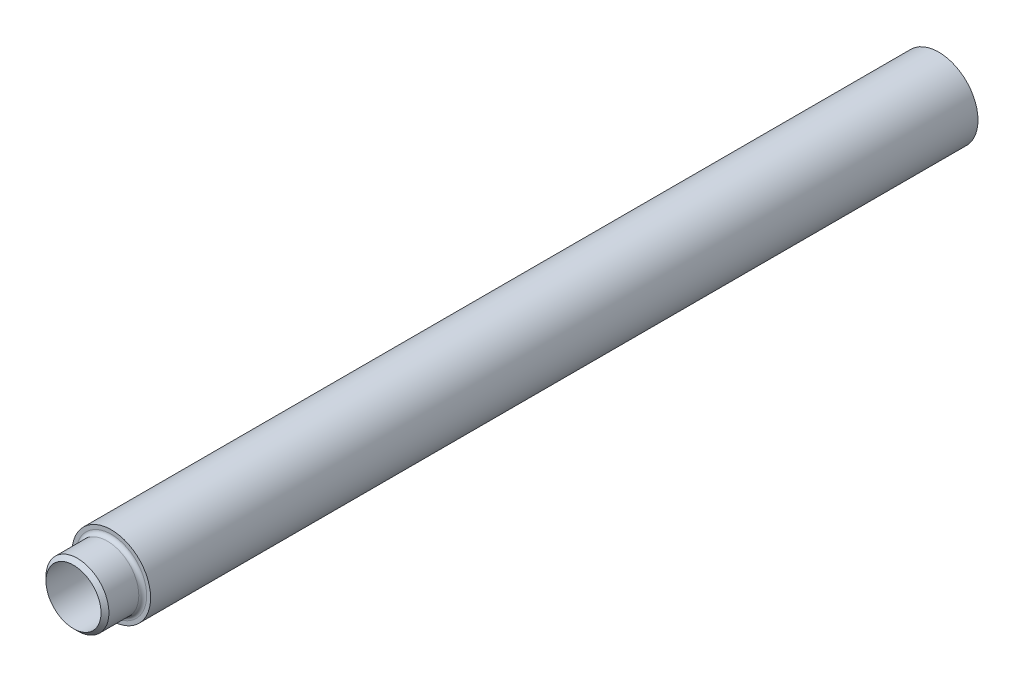
from build123d import *

# Parameters (mm, degrees)
SKETCH1_R           = 12.7
BOSS_EXTRUDE1_DEPTH = 279.4
SKETCH2_R           = 8.89
CUT_EXTRUDE1_DEPTH  = 280.9766776
SKETCH3_R           = 10.033
CUT_EXTRUDE2_DEPTH  = 12.7
CUT_EXTRUDE3_START  = -12.192
SKETCH4_R           = 12.7
SKETCH4_R_2         = 10.16
CUT_EXTRUDE3_DEPTH  = 12.192
FILLET1_R           = 1.27
CHAMFER1_SIZE       = 1.27
FILLET2_R           = 0.635
CHAMFER2_SIZE       = 1.27


with BuildPart() as part:
    # Sketch1 → Boss-Extrude1 (new body)
    with BuildSketch(Plane.XY):
        Circle(SKETCH1_R)
    extrude(amount=BOSS_EXTRUDE1_DEPTH)

    # Sketch2 → Cut-Extrude1 (cut, through all)
    with BuildSketch(Plane(origin=(0, 0, 0), x_dir=(-1, 0, 0), z_dir=(0, 0, -1))):
        Circle(SKETCH2_R)
    extrude(amount=-CUT_EXTRUDE1_DEPTH, mode=Mode.SUBTRACT)

    # Sketch3 → Cut-Extrude2 (cut)
    with BuildSketch(Plane(origin=(0, 0, 0), x_dir=(-1, 0, 0), z_dir=(0, 0, -1))):
        Circle(SKETCH3_R)
    extrude(amount=-CUT_EXTRUDE2_DEPTH, mode=Mode.SUBTRACT)

    # Sketch4 → Cut-Extrude3 (cut)
    with BuildSketch(Plane.XY.offset(279.4).offset(CUT_EXTRUDE3_START)):
        Circle(SKETCH4_R)
        Circle(SKETCH4_R_2, mode=Mode.SUBTRACT)
    extrude(amount=CUT_EXTRUDE3_DEPTH, mode=Mode.SUBTRACT)

    # Fillet1
    fillet1_edges = [part.edges().sort_by_distance(p)[0] for p in [
        (-10.16, 0, 267.208),
    ]]
    fillet(fillet1_edges, radius=FILLET1_R)

    # Chamfer1
    chamfer1_edges = [part.edges().sort_by_distance(p)[0] for p in [
        (10.033, 0, 0),
    ]]
    chamfer(chamfer1_edges, length=CHAMFER1_SIZE)

    # Fillet2
    fillet2_edges = [part.edges().sort_by_distance(p)[0] for p in [
        (10.033, 0, 12.7),
    ]]
    fillet(fillet2_edges, radius=FILLET2_R)

    # Chamfer2
    chamfer2_edges = [part.edges().sort_by_distance(p)[0] for p in [
        (-10.16, 0, 279.4),
    ]]
    chamfer(chamfer2_edges, length=CHAMFER2_SIZE - 0.0001)  # a hair under: the kernel refuses the full size


solid = part.part
